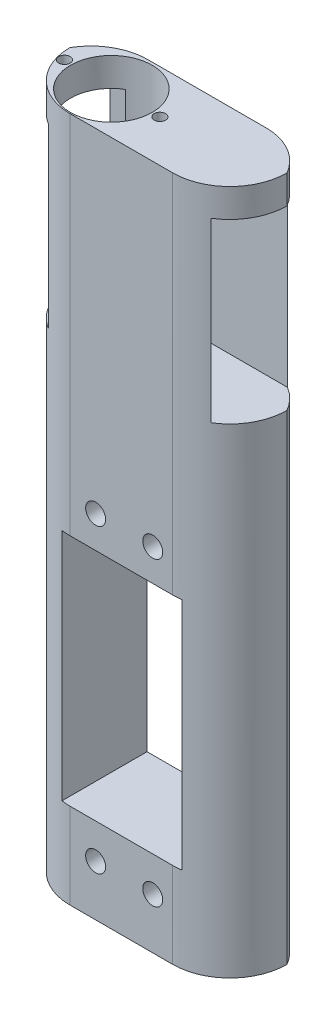
from build123d import *

# Parameters (mm, degrees)
SKETCH1_W           = 38
SKETCH1_H           = 120
BOSS_EXTRUDE1_DEPTH = 15
SKETCH2_W           = 21
SKETCH2_H           = 41
CUT_EXTRUDE2_DEPTH  = 15
SKETCH3_R           = 1.75
CUT_EXTRUDE4_DEPTH  = 15
SKETCH6_W           = 12.0625825
SKETCH6_H           = 31
CUT_EXTRUDE8_DEPTH  = 38
SKETCH8_R           = 7.155544399
SKETCH8_R_2         = 1
CUT_EXTRUDE10_DEPTH = 10
FILLET2_R           = 10
FILLET3_R           = 10


with BuildPart() as part:
    # Sketch1 → Boss-Extrude1 (new body)
    with BuildSketch(Plane.XY):
        with Locations((-1.743801653, -11.107438017)):
            Rectangle(SKETCH1_W, SKETCH1_H)
    extrude(amount=BOSS_EXTRUDE1_DEPTH)

    # Sketch2 → Cut-Extrude2 (cut)
    with BuildSketch(Plane.XY.offset(15)):
        with Locations((-1.743801653, -35.607438017)):
            Rectangle(SKETCH2_W, SKETCH2_H)
    extrude(amount=-CUT_EXTRUDE2_DEPTH, mode=Mode.SUBTRACT)

    # Sketch3 → Cut-Extrude4 (cut)
    with BuildSketch(Plane.XY.offset(15)):
        with Locations((-6.243801653, -9.517630565)):
            Circle(SKETCH3_R)
        with Locations((3.756198347, -9.517630565)):
            Circle(SKETCH3_R)
        with Locations((-6.243801653, -62.215563881)):
            Circle(SKETCH3_R)
        with Locations((3.756198347, -62.215563881)):
            Circle(SKETCH3_R)
    extrude(amount=-CUT_EXTRUDE4_DEPTH, mode=Mode.SUBTRACT)

    # Sketch6 → Cut-Extrude8 (cut)
    with BuildSketch(Plane(origin=(17.256198347, 0, 0), x_dir=(0, 0, -1), z_dir=(1, 0, 0))):
        with Locations((-7.5, 28.392561983)):
            Rectangle(SKETCH6_W, SKETCH6_H)
    extrude(amount=-CUT_EXTRUDE8_DEPTH, mode=Mode.SUBTRACT)

    # Sketch8 → Cut-Extrude10 (cut)
    with BuildSketch(Plane(origin=(0, 48.892561983, 0), x_dir=(1, 0, 0), z_dir=(0, 1, 0))):
        with Locations(Location((-10.864699175, -7.628809465, 0), (0, 0, 270))):
            Circle(SKETCH8_R)
        with Locations(Location((-19.364699175, -7.340375333, 0), (0, 0, 270))):
            Circle(SKETCH8_R_2)
        with Locations(Location((-2.364699175, -7.628809465, 0), (0, 0, 270))):
            Circle(SKETCH8_R_2)
    extrude(amount=-CUT_EXTRUDE10_DEPTH, mode=Mode.SUBTRACT)

    # Fillet2
    # the kernel refuses this fillet: 10 mm, written as the material it takes off along each edge
    with BuildSketch(Plane(origin=(-20.743801653, -96.107438017, 15), x_dir=(0, 0, -1), z_dir=(0, 1, 0))) as fillet2_piece_1:
        with BuildLine():
            CenterArc((FILLET2_R, -FILLET2_R), FILLET2_R, 90, 90)
            Line((0, -FILLET2_R), (0, 0))
            Line((0, 0), (FILLET2_R, 0))
        make_face()
    extrude(amount=170, mode=Mode.SUBTRACT)
    with BuildSketch(Plane(origin=(17.256198347, 73.892561983, 15), x_dir=(-1, 0, 0), z_dir=(0, -1, 0))) as fillet2_piece_2:
        with BuildLine():
            CenterArc((FILLET2_R, FILLET2_R), FILLET2_R, 180, 90)
            Line((0, FILLET2_R), (0, 0))
            Line((0, 0), (FILLET2_R, 0))
        make_face()
    extrude(amount=170, mode=Mode.SUBTRACT)

    # Fillet3
    # the kernel refuses this fillet: 10 mm, written as the material it takes off along each edge
    with BuildSketch(Plane(origin=(-20.743801653, -92.758073111, 0), x_dir=(1, 0, 0), z_dir=(0, 1, 0)), Plane(origin=(17.256198347, 70.543197078, 0), x_dir=(-1, 0, 0), z_dir=(0, -1, 0))) as fillet3_piece_1:
        with BuildLine():
            CenterArc((8.660254038, -10), FILLET3_R, 90, 60)
            Line((0, -5), (-0.173205081, -4.9))
            ThreePointArc((-0.173205081, -4.9), (-0.2, -2.5), (-0.2, 0))
            Line((-0.2, 0), (0, 0.2))
            Line((0, 0.2), (8.660254038, 0.2))
            Line((8.660254038, 0.2), (8.660254038, 0))
        make_face()
    extrude(amount=163.301270189, mode=Mode.SUBTRACT)


solid = part.part
